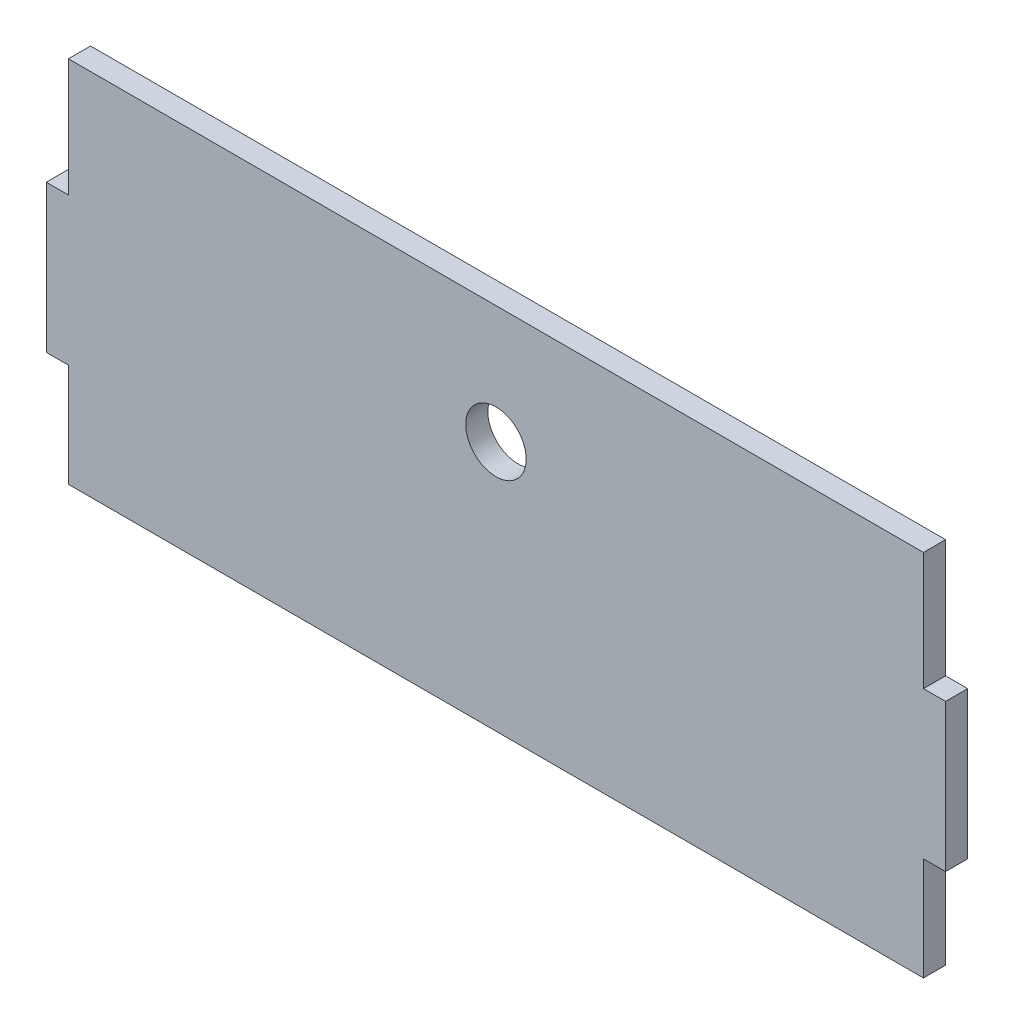
from build123d import *

# Parameters (mm, degrees)
SKETCH1_R           = 4.1
BOSS_EXTRUDE1_DEPTH = 3


with BuildPart() as part:
    # Sketch1 → Boss-Extrude1 (new body)
    with BuildSketch(Plane.XY):
        Polygon((-61, 10), (-61, -10), (-58, -10), (-58, -24), (58, -24), (58, -10), (61, -10), (61, 10), (58, 10), (58, 26), (-58, 26), (-58, 10), align=None)
        with Locations((0, 10)):
            Circle(SKETCH1_R, mode=Mode.SUBTRACT)
    extrude(amount=BOSS_EXTRUDE1_DEPTH)


solid = part.part
